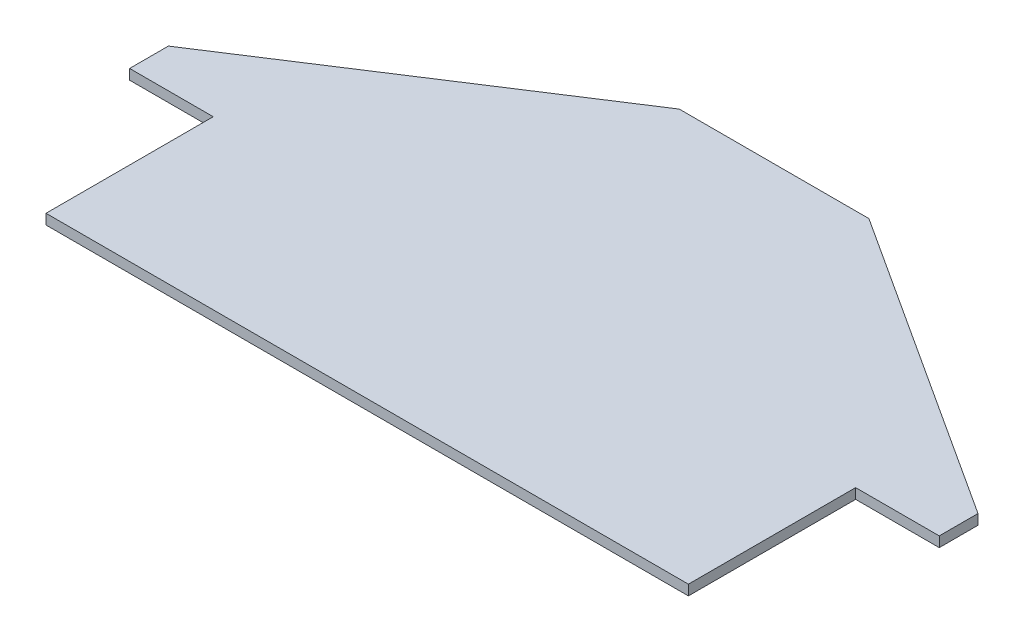
from build123d import *

# Parameters (mm, degrees)
BOSS_EXTRUDE1_DEPTH = 2.54


with BuildPart() as part:
    # Sketch1 → Boss-Extrude1 (new body)
    with BuildSketch(Plane(origin=(0, 0, 0), x_dir=(1, 0, 0), z_dir=(0, 1, 0))):
        Polygon((-80.01, 0), (80.01, 0), (80.01, 41.656), (100.838, 41.656), (100.838, 51.308), (23.622, 101.346), (-23.622, 101.346), (-100.838, 51.308), (-100.838, 41.656), (-80.01, 41.656), align=None)
    extrude(amount=BOSS_EXTRUDE1_DEPTH)


solid = part.part
